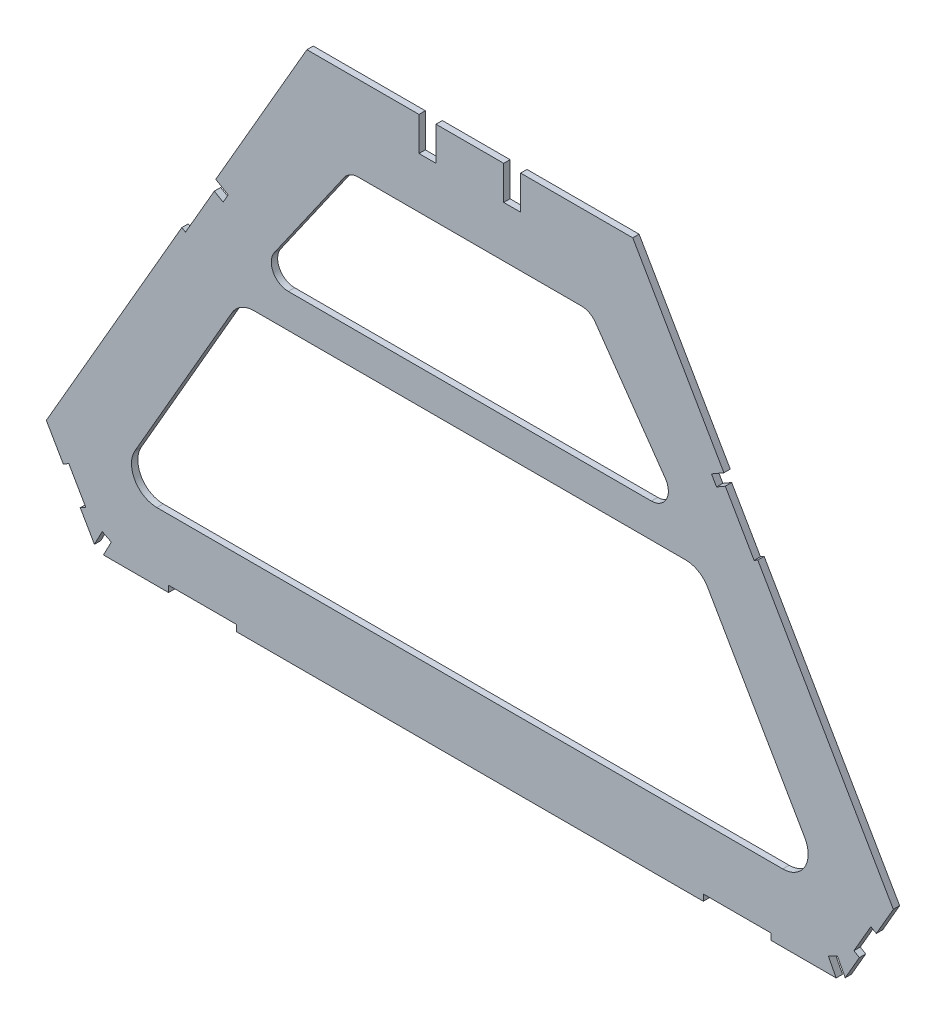
from build123d import *

# Parameters (mm, degrees)
BOSS_EXTRUDE1_DEPTH = 4.7625
CUT_EXTRUDE5_DEPTH  = 515.11412225
CUT_EXTRUDE15_DEPTH = 4.7625
FILLET1_R           = 19.05
CUT_EXTRUDE9_DEPTH  = 515.11412225
CUT_EXTRUDE10_DEPTH = 515.11412225
SKETCH4_W           = 50.8
SKETCH4_H           = 4.7625
CUT_EXTRUDE11_DEPTH = 515.11412225
SKETCH14_W          = 12.7
SKETCH14_H          = 25.4
CUT_EXTRUDE12_DEPTH = 515.11412225
CUT_EXTRUDE13_REACH = 516.114
CUT_EXTRUDE14_REACH = 516.114
MIRROR1_DEPTH       = 4.7625


# Read off the part's stored shape, not the designer's step: Mirror1
with BuildPart() as part:
    # Sketch3 → Boss-Extrude1 (new body)
    with BuildSketch(Plane.XY):
        Polygon((-317.5, 65.991135768), (-279.4, 0), (279.4, 0), (317.5, 65.991135768), (122.15878735, 404.332040891), (-122.15878735, 404.332040891), align=None)
    extrude(amount=BOSS_EXTRUDE1_DEPTH)

    # Sketch7 → Cut-Extrude5 (cut, through all)
    with BuildSketch(Plane.XY.offset(4.7625)):
        with BuildLine():
            Line((-136.142811828, 240.411), (136.142811828, 240.411))
            ThreePointArc((136.142811828, 240.411), (147.405476624, 247.242236784), (146.551931965, 260.387002884))
            Line((146.551931965, 260.387002884), (94.11202324, 335.408043775))
            ThreePointArc((94.11202324, 335.408043775), (89.571666319, 339.394705687), (83.702903103, 340.832040891))
            Line((83.702903103, 340.832040891), (-83.702903103, 340.832040891))
            ThreePointArc((-83.702903103, 340.832040891), (-89.571666319, 339.394705687), (-94.11202324, 335.408043775))
            Line((-94.11202324, 335.408043775), (-146.551931965, 260.387002884))
            ThreePointArc((-146.551931965, 260.387002884), (-147.405476624, 247.242236784), (-136.142811828, 240.411))
        make_face()
    extrude(amount=-CUT_EXTRUDE5_DEPTH, mode=Mode.SUBTRACT)

    # Sketch11 → Cut-Extrude15 (cut)
    with BuildSketch(Plane.XY.offset(4.7625)):
        Polygon((-172.804553922, 215.011), (172.804553922, 215.011), (267.611818975, 50.8), (-267.611818975, 50.8), align=None)
    extrude(amount=-CUT_EXTRUDE15_DEPTH, mode=Mode.SUBTRACT)

    # Fillet1
    fillet1_edges = [part.edges().sort_by_distance(p)[0] for p in [
        (172.804553922, 215.011, 2.38125),
        (-172.804553922, 215.011, 2.38125),
        (-267.611818975, 50.8, 2.38125),
        (267.611818975, 50.8, 2.38125),
    ]]
    fillet(fillet1_edges, radius=FILLET1_R)

    # Sketch12 → Cut-Extrude9 (cut, through all)
    with BuildSketch(Plane.XY.offset(4.7625)):
        Polygon((215.9, 241.967497817), (190.5, 285.96158833), (187.750369343, 284.37408833), (213.150369343, 240.379997817), align=None)
        Polygon((-187.750369343, 284.37408833), (-213.150369343, 240.379997817), (-215.9, 241.967497817), (-190.5, 285.96158833), align=None)
    extrude(amount=-CUT_EXTRUDE9_DEPTH, mode=Mode.SUBTRACT)

    # Sketch13 → Cut-Extrude10 (cut, through all)
    with BuildSketch(Plane.XY.offset(4.7625)):
        Polygon((292.077815329, 21.958620278), (287.953369343, 24.339870278), (300.653369343, 46.336915534), (304.777815329, 43.955665534), align=None)
        Polygon((-300.653369343, 46.336915534), (-304.777815329, 43.955665534), (-292.077815329, 21.958620278), (-287.953369343, 24.339870278), align=None)
    extrude(amount=-CUT_EXTRUDE10_DEPTH, mode=Mode.SUBTRACT)

    # Sketch4 → Cut-Extrude11 (cut, through all)
    with BuildSketch(Plane.XY.offset(4.7625)):
        with Locations((200.450369343, 2.38125)):
            Rectangle(SKETCH4_W, SKETCH4_H)
        with Locations((-200.450369343, 2.38125)):
            Rectangle(SKETCH4_W, SKETCH4_H)
    extrude(amount=-CUT_EXTRUDE11_DEPTH, mode=Mode.SUBTRACT)

    # Sketch14 → Cut-Extrude12 (cut, through all)
    with BuildSketch(Plane.XY.offset(4.7625)):
        with Locations((-31.75, 391.632040891)):
            Rectangle(SKETCH14_W, SKETCH14_H)
        with Locations((31.75, 391.632040891)):
            Rectangle(SKETCH14_W, SKETCH14_H)
    extrude(amount=-CUT_EXTRUDE12_DEPTH, mode=Mode.SUBTRACT)

    # Sketch15 → Cut-Extrude13 (cut, up to next)
    with BuildSketch(Plane.XY.offset(4.7625), mode=Mode.PRIVATE) as cut_extrude13_sk1:
        Polygon((-281.426680084, 3.510312876), (-274.663389205, 0), (-268.812867745, 11.272151465), (-275.576158624, 14.782464341), align=None)
    cut_extrude13_tool1 = extrude(cut_extrude13_sk1.sketch, amount=-CUT_EXTRUDE13_REACH, mode=Mode.PRIVATE) & part.part
    add(cut_extrude13_tool1.solids().sort_by_distance((-275.119774, 7.391232, 4.7625))[0], mode=Mode.SUBTRACT)


with BuildPart() as cut_extrude13_kept_piece:
    # of the separate pieces the step leaves, the one the design keeps (cut_extrude13_pieces_kept)
    add(part.part.solids().sort_by_distance((-122.15878735, 404.332040891, 0))[0])

    # Sketch16 → Cut-Extrude14 (cut, up to next)
    with BuildSketch(Plane.XY.offset(4.7625), mode=Mode.PRIVATE) as cut_extrude14_sk1:
        Polygon((-187.750369343, 284.37408833), (-191.560369343, 277.774974753), (-184.961255766, 273.964974753), (-181.151255766, 280.56408833), align=None)
    cut_extrude14_tool1 = extrude(cut_extrude14_sk1.sketch, amount=-CUT_EXTRUDE14_REACH, mode=Mode.PRIVATE) & cut_extrude13_kept_piece.part
    add(cut_extrude14_tool1.solids().sort_by_distance((-186.355813, 279.169532, 4.7625))[0], mode=Mode.SUBTRACT)

    # Mirror1 outline → Mirror1 (cut)
    with BuildSketch(Plane.XY):
        Polygon((191.560369343, 277.774974753), (187.750369343, 284.37408833), (181.151255766, 280.56408833), (184.961255766, 273.964974753), align=None)
        Polygon((281.426680084, 3.510312876), (275.576158624, 14.782464341), (268.812867745, 11.272151465), (274.663389205, 0), (279.4, 0), align=None)
    extrude(amount=MIRROR1_DEPTH, mode=Mode.SUBTRACT)


solid = cut_extrude13_kept_piece.part
